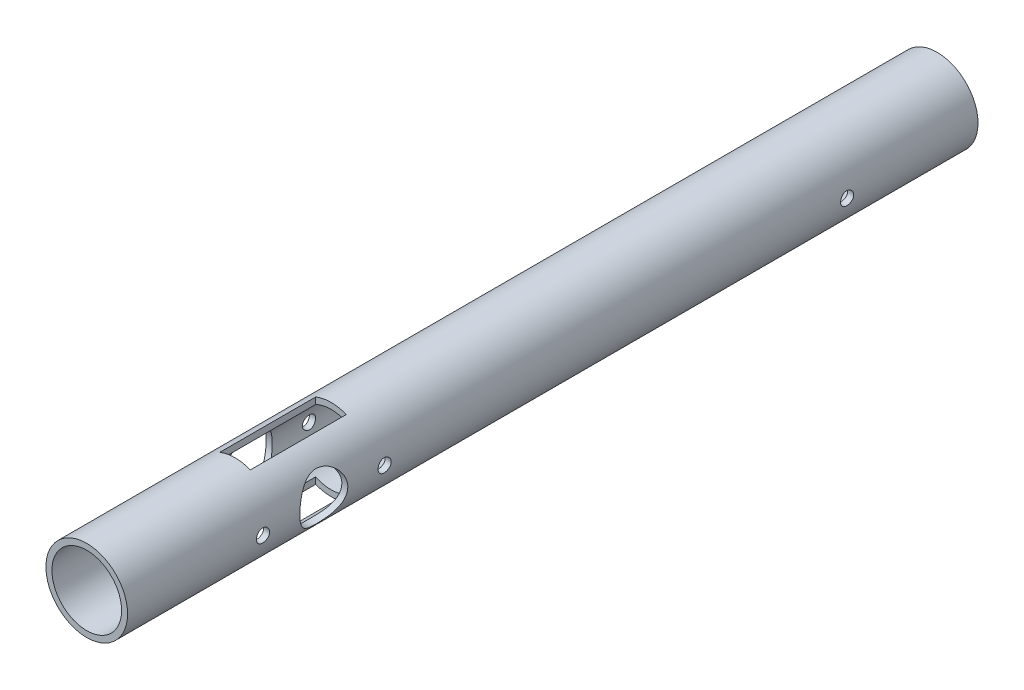
from build123d import *

# Parameters (mm, degrees)
SKETCH1_R           = 9.36
SKETCH1_R_2         = 7.99
EXTRUDE1_DEPTH      = 195
EXTRUDE2_DEPTH      = 196.448763618
EXTRUDE2_DEPTH_BACK = 196.448763618
SKETCH2_R           = 1.5
SKETCH2_R_2         = 5.5
EXTRUDE3_DEPTH      = 25
EXTRUDE3_DEPTH_BACK = 25
SKETCH3_W           = 7
SKETCH3_H           = 22


with BuildPart() as part:
    # Sketch1 → Extrude1 (new body)
    with BuildSketch(Plane.XY):
        Circle(SKETCH1_R)
        Circle(SKETCH1_R_2, mode=Mode.SUBTRACT)
    extrude(amount=EXTRUDE1_DEPTH)

    # Sketch2 → Extrude2 (cut, two sides: drawn at the far end of the back side and taken through both)
    with BuildSketch(Plane(origin=(0, 0, 0), x_dir=(0, 0, -1), z_dir=(1, 0, 0)).offset(-EXTRUDE2_DEPTH_BACK)):
        with Locations((-30, 0)):
            Circle(SKETCH2_R)
        with Locations((-150, 0)):
            Circle(SKETCH2_R_2)
        with Locations((-136.0625, 0)):
            Circle(SKETCH2_R)
        with Locations((-163.9375, 0)):
            Circle(SKETCH2_R)
    extrude(amount=EXTRUDE2_DEPTH + EXTRUDE2_DEPTH_BACK, mode=Mode.SUBTRACT)

    # Sketch3 → Extrude3 (cut, two sides: drawn at the far end of the back side and taken through both)
    with BuildSketch(Plane(origin=(0, 0, 0), x_dir=(1, 0, 0), z_dir=(0, 1, 0)).offset(-EXTRUDE3_DEPTH_BACK)):
        with Locations((0, -150)):
            Rectangle(SKETCH3_W, SKETCH3_H)
    extrude(amount=EXTRUDE3_DEPTH + EXTRUDE3_DEPTH_BACK, mode=Mode.SUBTRACT)


solid = part.part
